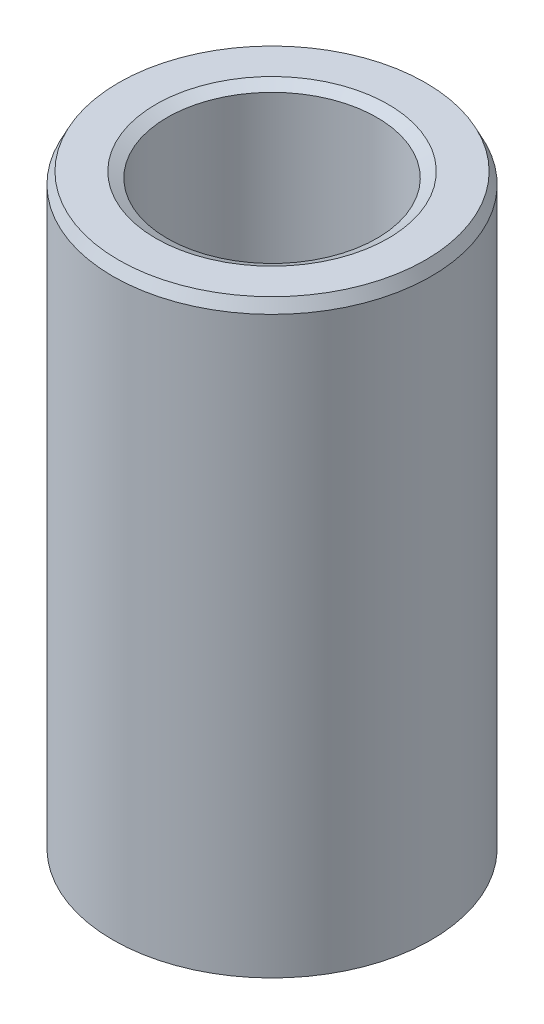
from build123d import *
from OCP.BRepFilletAPI import BRepFilletAPI_MakeChamfer

# Parameters (mm, degrees)
SKETCH1_R           = 50
BOSS_EXTRUDE1_DEPTH = 185.835119312
SKETCH2_R           = 32.925806839
CUT_EXTRUDE1_DEPTH  = 199.833326104
CHAMFER1_SIZE       = 3.557614791
CHAMFER1_SIZE2      = 1.780383547


with BuildPart() as part:
    # Sketch1 → Boss-Extrude1 (new body)
    with BuildSketch(Plane(origin=(0, 0, 0), x_dir=(1, 0, 0), z_dir=(0, 1, 0))):
        Circle(SKETCH1_R)
    extrude(amount=BOSS_EXTRUDE1_DEPTH)

    # Sketch2 → Cut-Extrude1 (cut, through all)
    with BuildSketch(Plane(origin=(0, 0, 0), x_dir=(1, 0, 0), z_dir=(0, 1, 0))):
        Circle(SKETCH2_R)
    extrude(amount=CUT_EXTRUDE1_DEPTH, mode=Mode.SUBTRACT)

    # Chamfer1: one chamfer whose edges measure the first distance from different faces: ONE call of the kernel's chamfer builder (chamfer() names one face for all edges)
    chamfer1_edges_1 = [part.edges().sort_by_distance(p)[0] for p in [
        (-32.925806839, 185.835119312, 0),
    ]]
    chamfer1_side_1 = [part.faces().sort_by_distance(p)[0] for p in [
        (-48.585786438, 185.835119312, 0),
    ]]
    chamfer1_edges_2 = [part.edges().sort_by_distance(p)[0] for p in [
        (-32.925806839, 0, 0),
    ]]
    chamfer1_side_2 = [part.faces().sort_by_distance(p)[0] for p in [
        (-32.925806839, 92.917559656, 0),
    ]]
    chamfer1_edges_3 = [part.edges().sort_by_distance(p)[0] for p in [
        (-50, 0, 0),
    ]]
    chamfer1_side_3 = [part.faces().sort_by_distance(p)[0] for p in [
        (-48.585786438, 0, 0),
    ]]
    chamfer1_edges_4 = [part.edges().sort_by_distance(p)[0] for p in [
        (-50, 185.835119312, 0),
    ]]
    chamfer1_side_4 = [part.faces().sort_by_distance(p)[0] for p in [
        (-50, 92.917559656, 0),
    ]]
    chamfer1 = BRepFilletAPI_MakeChamfer(part.part.solid().wrapped)
    for e in chamfer1_edges_1:
        chamfer1.Add(CHAMFER1_SIZE, CHAMFER1_SIZE2, e.wrapped, chamfer1_side_1[0].wrapped)  # the first distance lies on this face
    for e in chamfer1_edges_2:
        chamfer1.Add(CHAMFER1_SIZE, CHAMFER1_SIZE2, e.wrapped, chamfer1_side_2[0].wrapped)  # the first distance lies on this face
    for e in chamfer1_edges_3:
        chamfer1.Add(CHAMFER1_SIZE, CHAMFER1_SIZE2, e.wrapped, chamfer1_side_3[0].wrapped)  # the first distance lies on this face
    for e in chamfer1_edges_4:
        chamfer1.Add(CHAMFER1_SIZE, CHAMFER1_SIZE2, e.wrapped, chamfer1_side_4[0].wrapped)  # the first distance lies on this face
    add(Compound.cast(chamfer1.Shape()), mode=Mode.REPLACE)


solid = part.part
